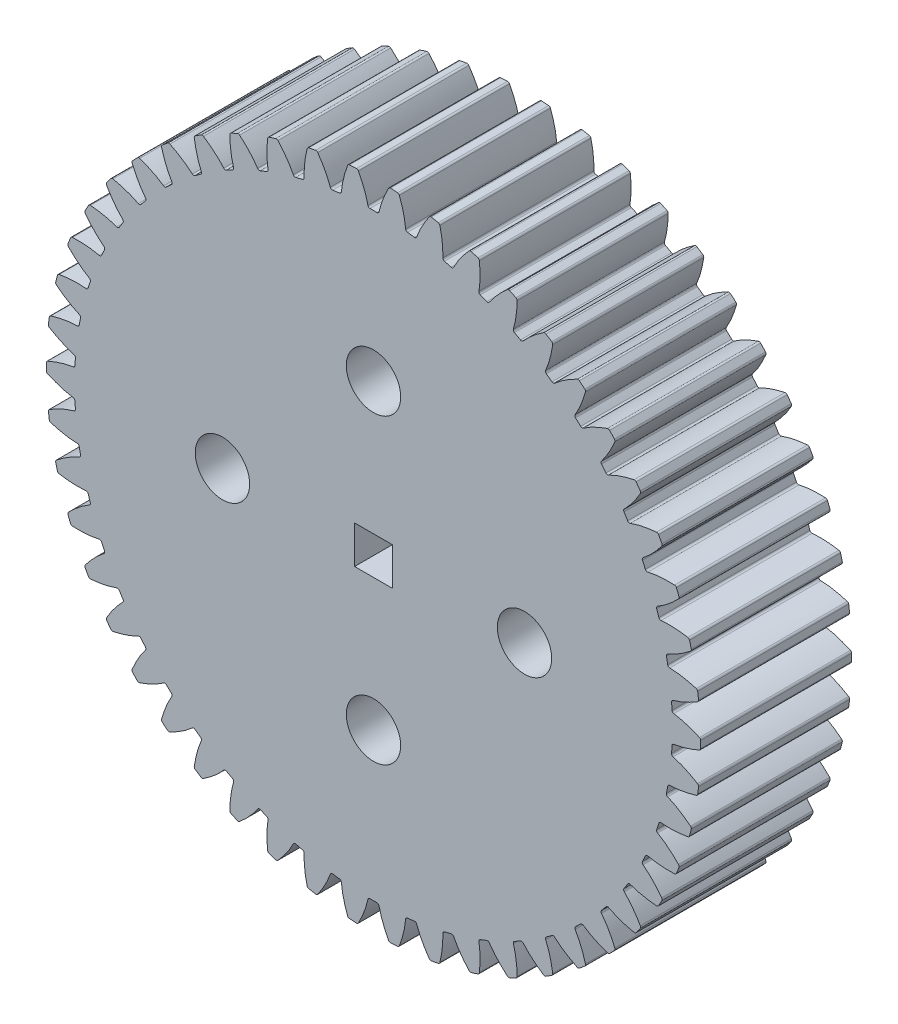
from build123d import *

# Parameters (mm, degrees)
SKETCH1_R                                = 27.516666667
BOSS_EXTRUDE1_DEPTH                      = 12.7
CUT_EXTRUDE_DCGTBC_DEPTH                 = 41.934385166
FILLET_TIP_DCGTBC_R                      = 0.177538081
CIRPATTERN_DCGTBC_COUNT                  = 50
FILLET_TIP_DCGTBC_OF_CIRPATTERN_DCGTBC_R = 0.177538081
SKETCH4_W                                = 3.175
SKETCH4_H                                = 3.175
CUT_EXTRUDE2_DEPTH                       = 41.909507697
SKETCH5_R                                = 2.286
CUT_EXTRUDE3_DEPTH                       = 41.909507697


with BuildPart() as part:
    # Sketch1 → Boss-Extrude1 (new body)
    with BuildSketch(Plane.XY):
        Circle(SKETCH1_R)
    extrude(amount=BOSS_EXTRUDE1_DEPTH)

    # DCGTBC → Cut-Extrude-DCGTBC (cut, through all)
    with BuildSketch(Plane.XY):
        with BuildLine():
            add(Edge.make_bspline(
                [(0.442092744, 25.131528505), (0.442464154, 25.13375878), (0.44631015, 25.15673805), (0.453993097, 25.200405971), (0.466269796, 25.264634708), (0.483587465, 25.346974427), (0.502322924, 25.429052638), (0.522303739, 25.51075794), (0.548064674, 25.609655733), (0.581120058, 25.728137465), (0.622914493, 25.866455878), (0.67404358, 26.023119881), (0.730143485, 26.182547659), (0.788625755, 26.339221425), (0.851489936, 26.497270735), (0.914989295, 26.650014802), (0.984818861, 26.808399553), (1.051243742, 26.954459267), (1.129955289, 27.117785786), (1.194728265, 27.249500712), (1.265221187, 27.385291083), (1.300059424, 27.451340948), (1.318086832, 27.485079435)],
                knots=[0.089169482, 0.089169482, 0.089169482, 0.089169482, 0.089169482, 0.092110526, 0.119476176, 0.146842496, 0.174208854, 0.201574956, 0.228941013, 0.256307345, 0.307035032, 0.361767352, 0.416499661, 0.471231937, 0.525964282, 0.580696616, 0.635428982, 0.690161387, 0.744893688, 0.799626082, 0.854358407, 0.909090914, 0.909090914, 0.909090914, 0.909090914, 0.909090914], degree=4))
            ThreePointArc((1.318086832, 27.485079435), (0, 27.516666667), (-1.318086832, 27.485079435))
            add(Edge.make_bspline(
                [(-0.442092744, 25.131528505), (-0.442464154, 25.13375878), (-0.44631015, 25.15673805), (-0.453993097, 25.200405971), (-0.466269796, 25.264634708), (-0.483587465, 25.346974427), (-0.502322924, 25.429052638), (-0.522303739, 25.51075794), (-0.548064674, 25.609655733), (-0.581120058, 25.728137465), (-0.622914493, 25.866455878), (-0.67404358, 26.023119881), (-0.730143485, 26.182547659), (-0.788625755, 26.339221425), (-0.851489936, 26.497270735), (-0.914989295, 26.650014802), (-0.984818861, 26.808399553), (-1.051243742, 26.954459267), (-1.129955289, 27.117785786), (-1.194728265, 27.249500712), (-1.265221187, 27.385291083), (-1.300059424, 27.451340948), (-1.318086832, 27.485079435)],
                knots=[0.089169482, 0.089169482, 0.089169482, 0.089169482, 0.089169482, 0.092110526, 0.119476176, 0.146842496, 0.174208854, 0.201574956, 0.228941013, 0.256307345, 0.307035032, 0.361767352, 0.416499661, 0.471231937, 0.525964282, 0.580696616, 0.635428982, 0.690161387, 0.744893688, 0.799626082, 0.854358407, 0.909090914, 0.909090914, 0.909090914, 0.909090914, 0.909090914], degree=4))
            ThreePointArc((-0.442092744, 25.131528505), (0, 25.135416667), (0.442092744, 25.131528505))
        make_face()
    cut_extrude_dcgtbc = extrude(amount=CUT_EXTRUDE_DCGTBC_DEPTH, mode=Mode.SUBTRACT)

    # Fillet-Tip-DCGTBC
    fillet_tip_dcgtbc_edges = [part.edges().sort_by_distance(p)[0] for p in [
        (1.318086832, 27.485079435, 6.35),
        (-1.318086832, 27.485079435, 6.35),
        (0.442092744, 25.131528505, 6.35),
        (-0.442092744, 25.131528505, 6.35),
    ]]
    fillet(fillet_tip_dcgtbc_edges, radius=FILLET_TIP_DCGTBC_R)

    # CirPattern-DCGTBC: Cut-Extrude-DCGTBC ×50 about axis
    cirpattern_dcgtbc_axis = Axis((0, 0, 12.7), (0, 0, 1))
    for i in range(1, CIRPATTERN_DCGTBC_COUNT):
        add(cut_extrude_dcgtbc.rotate(cirpattern_dcgtbc_axis, i * 360 / CIRPATTERN_DCGTBC_COUNT), mode=Mode.SUBTRACT)

    # Fillet-Tip-DCGTBC of CirPattern-DCGTBC
    fillet_tip_dcgtbc_of_cirpattern_dcgtbc_edges = [part.edges().sort_by_distance(p)[0] for p in [
        (-2.137100557, 27.433551459, 6.35),
        (-4.752487204, 27.10315129, 6.35),
        (-2.711209022, 24.98876781, 6.35),
        (-3.588422442, 24.877949984, 6.35),
        (-5.558584593, 26.949379988, 6.35),
        (-8.111938014, 26.293790258, 6.35),
        (-5.821753401, 24.451919318, 6.35),
        (-6.678160575, 24.232031329, 6.35),
        (-8.89240643, 26.040200697, 6.35),
        (-11.343458715, 25.069760446, 6.35),
        (-8.840485252, 23.529449452, 6.35),
        (-9.662580127, 23.203959065, 6.35),
        (-12.085989705, 24.720351884, 6.35),
        (-14.396086296, 23.450365536, 6.35),
        (-11.719797369, 22.235906112, 6.35),
        (-12.494615018, 21.809946505, 6.35),
        (-15.088969703, 23.010648356, 6.35),
        (-17.221678997, 21.461144354, 6.35),
        (-14.41428128, 20.59168925, 6.35),
        (-15.129602366, 20.071978061, 6.35),
        (-17.853987635, 20.938053156, 6.35),
        (-19.775675532, 19.133468104, 6.35),
        (-16.881443365, 18.622729148, 6.35),
        (-17.525986846, 18.017462531, 6.35),
        (-20.337437516, 18.535252351, 6.35),
        (-22.017797851, 16.504045633, 6.35),
        (-19.082375004, 16.360077482, 6.35),
        (-19.645976045, 15.678800855, 6.35),
        (-22.500153859, 15.840139544, 6.35),
        (-23.912686344, 13.614344503, 6.35),
        (-20.98236619, 13.839417621, 6.35),
        (-21.456136465, 13.092875123, 6.35),
        (-24.308029335, 12.895218273, 6.35),
        (-25.430457489, 10.509937028, 6.35),
        (-22.551452926, 11.100501877, 6.35),
        (-22.927920797, 10.300466929, 6.35),
        (-25.732552666, 9.746931708, 6.35),
        (-26.547175129, 7.239781567, 6.35),
        (-23.764889779, 8.186524587, 6.35),
        (-24.03811812, 7.345614218, 6.35),
        (-26.751258271, 6.444930206, 6.35),
        (-27.245227958, 3.855450426, 6.35),
        (-24.603540123, 5.143440914, 6.35),
        (-24.769219962, 4.274916783, 6.35),
        (-27.348080552, 3.041288306, 6.35),
        (-27.513607266, 0.410316529, 6.35),
        (-25.054177942, 2.019242106, 6.35),
        (-25.109696408, 1.136801357, 6.35),
        (-27.513607266, -0.410316529, 6.35),
        (-27.348080552, -3.041288306, 6.35),
        (-25.109696408, -1.136801357, 6.35),
        (-25.054177942, -2.019242106, 6.35),
        (-27.245227958, -3.855450426, 6.35),
        (-26.751258271, -6.444930206, 6.35),
        (-24.769219962, -4.274916783, 6.35),
        (-24.603540123, -5.143440914, 6.35),
        (-26.547175129, -7.239781567, 6.35),
        (-25.732552666, -9.746931708, 6.35),
        (-24.03811812, -7.345614218, 6.35),
        (-23.764889779, -8.186524587, 6.35),
        (-25.430457489, -10.509937028, 6.35),
        (-24.308029335, -12.895218273, 6.35),
        (-22.927920797, -10.300466929, 6.35),
        (-22.551452926, -11.100501877, 6.35),
        (-23.912686344, -13.614344503, 6.35),
        (-22.500153859, -15.840139544, 6.35),
        (-21.456136465, -13.092875123, 6.35),
        (-20.98236619, -13.839417621, 6.35),
        (-22.017797851, -16.504045633, 6.35),
        (-20.337437516, -18.535252351, 6.35),
        (-19.645976045, -15.678800855, 6.35),
        (-19.082375004, -16.360077482, 6.35),
        (-19.775675532, -19.133468104, 6.35),
        (-17.853987635, -20.938053156, 6.35),
        (-17.525986846, -18.017462531, 6.35),
        (-16.881443365, -18.622729148, 6.35),
        (-17.221678997, -21.461144354, 6.35),
        (-15.088969703, -23.010648356, 6.35),
        (-15.129602366, -20.071978061, 6.35),
        (-14.41428128, -20.59168925, 6.35),
        (-14.396086296, -23.450365536, 6.35),
        (-12.085989705, -24.720351884, 6.35),
        (-12.494615018, -21.809946505, 6.35),
        (-11.719797369, -22.235906112, 6.35),
        (-11.343458715, -25.069760446, 6.35),
        (-8.89240643, -26.040200697, 6.35),
        (-9.662580127, -23.203959065, 6.35),
        (-8.840485252, -23.529449452, 6.35),
        (-8.111938014, -26.293790258, 6.35),
        (-5.558584593, -26.949379988, 6.35),
        (-6.678160575, -24.232031329, 6.35),
        (-5.821753401, -24.451919318, 6.35),
        (-4.752487204, -27.10315129, 6.35),
        (-2.137100557, -27.433551459, 6.35),
        (-3.588422442, -24.877949984, 6.35),
        (-2.711209022, -24.98876781, 6.35),
        (-1.318086832, -27.485079435, 6.35),
        (1.318086832, -27.485079435, 6.35),
        (-0.442092744, -25.131528505, 6.35),
        (0.442092744, -25.131528505, 6.35),
        (2.137100557, -27.433551459, 6.35),
        (4.752487204, -27.10315129, 6.35),
        (2.711209022, -24.98876781, 6.35),
        (3.588422442, -24.877949984, 6.35),
        (5.558584593, -26.949379988, 6.35),
        (8.111938014, -26.293790258, 6.35),
        (5.821753401, -24.451919318, 6.35),
        (6.678160575, -24.232031329, 6.35),
        (8.89240643, -26.040200697, 6.35),
        (11.343458715, -25.069760446, 6.35),
        (8.840485252, -23.529449452, 6.35),
        (9.662580127, -23.203959065, 6.35),
        (12.085989705, -24.720351884, 6.35),
        (14.396086296, -23.450365536, 6.35),
        (11.719797369, -22.235906112, 6.35),
        (12.494615018, -21.809946505, 6.35),
        (15.088969703, -23.010648356, 6.35),
        (17.221678997, -21.461144354, 6.35),
        (14.41428128, -20.59168925, 6.35),
        (15.129602366, -20.071978061, 6.35),
        (17.853987635, -20.938053156, 6.35),
        (19.775675532, -19.133468104, 6.35),
        (16.881443365, -18.622729148, 6.35),
        (17.525986846, -18.017462531, 6.35),
        (20.337437516, -18.535252351, 6.35),
        (22.017797851, -16.504045633, 6.35),
        (19.082375004, -16.360077482, 6.35),
        (19.645976045, -15.678800855, 6.35),
        (22.500153859, -15.840139544, 6.35),
        (23.912686344, -13.614344503, 6.35),
        (20.98236619, -13.839417621, 6.35),
        (21.456136465, -13.092875123, 6.35),
        (24.308029335, -12.895218273, 6.35),
        (25.430457489, -10.509937028, 6.35),
        (22.551452926, -11.100501877, 6.35),
        (22.927920797, -10.300466929, 6.35),
        (25.732552666, -9.746931708, 6.35),
        (26.547175129, -7.239781567, 6.35),
        (23.764889779, -8.186524587, 6.35),
        (24.03811812, -7.345614218, 6.35),
        (26.751258271, -6.444930206, 6.35),
        (27.245227958, -3.855450426, 6.35),
        (24.603540123, -5.143440914, 6.35),
        (24.769219962, -4.274916783, 6.35),
        (27.348080552, -3.041288306, 6.35),
        (27.513607266, -0.410316529, 6.35),
        (25.054177942, -2.019242106, 6.35),
        (25.109696408, -1.136801357, 6.35),
        (27.513607266, 0.410316529, 6.35),
        (27.348080552, 3.041288306, 6.35),
        (25.109696408, 1.136801357, 6.35),
        (25.054177942, 2.019242106, 6.35),
        (27.245227958, 3.855450426, 6.35),
        (26.751258271, 6.444930206, 6.35),
        (24.769219962, 4.274916783, 6.35),
        (24.603540123, 5.143440914, 6.35),
        (26.547175129, 7.239781567, 6.35),
        (25.732552666, 9.746931708, 6.35),
        (24.03811812, 7.345614218, 6.35),
        (23.764889779, 8.186524587, 6.35),
        (25.430457489, 10.509937028, 6.35),
        (24.308029335, 12.895218273, 6.35),
        (22.927920797, 10.300466929, 6.35),
        (22.551452926, 11.100501877, 6.35),
        (23.912686344, 13.614344503, 6.35),
        (22.500153859, 15.840139544, 6.35),
        (21.456136465, 13.092875123, 6.35),
        (20.98236619, 13.839417621, 6.35),
        (22.017797851, 16.504045633, 6.35),
        (20.337437516, 18.535252351, 6.35),
        (19.645976045, 15.678800855, 6.35),
        (19.082375004, 16.360077482, 6.35),
        (19.775675532, 19.133468104, 6.35),
        (17.853987635, 20.938053156, 6.35),
        (17.525986846, 18.017462531, 6.35),
        (16.881443365, 18.622729148, 6.35),
        (17.221678997, 21.461144354, 6.35),
        (15.088969703, 23.010648356, 6.35),
        (15.129602366, 20.071978061, 6.35),
        (14.41428128, 20.59168925, 6.35),
        (14.396086296, 23.450365536, 6.35),
        (12.085989705, 24.720351884, 6.35),
        (12.494615018, 21.809946505, 6.35),
        (11.719797369, 22.235906112, 6.35),
        (11.343458715, 25.069760446, 6.35),
        (8.89240643, 26.040200697, 6.35),
        (9.662580127, 23.203959065, 6.35),
        (8.840485252, 23.529449452, 6.35),
        (8.111938014, 26.293790258, 6.35),
        (5.558584593, 26.949379988, 6.35),
        (6.678160575, 24.232031329, 6.35),
        (5.821753401, 24.451919318, 6.35),
        (4.752487204, 27.10315129, 6.35),
        (2.137100557, 27.433551459, 6.35),
        (3.588422442, 24.877949984, 6.35),
        (2.711209022, 24.98876781, 6.35),
    ]]
    fillet(fillet_tip_dcgtbc_of_cirpattern_dcgtbc_edges, radius=FILLET_TIP_DCGTBC_OF_CIRPATTERN_DCGTBC_R)

    # Sketch4 → Cut-Extrude2 (cut, through all)
    with BuildSketch(Plane.XY.offset(12.7)):
        Rectangle(SKETCH4_W, SKETCH4_H)
    extrude(amount=-CUT_EXTRUDE2_DEPTH, mode=Mode.SUBTRACT)

    # Sketch5 → Cut-Extrude3 (cut, through all)
    with BuildSketch(Plane.XY.offset(12.7)):
        with Locations((-12.7, 0)):
            Circle(SKETCH5_R)
        with Locations((0, 12.7)):
            Circle(SKETCH5_R)
        with Locations((12.7, 0)):
            Circle(SKETCH5_R)
        with Locations((0, -12.7)):
            Circle(SKETCH5_R)
    extrude(amount=-CUT_EXTRUDE3_DEPTH, mode=Mode.SUBTRACT)


solid = part.part
